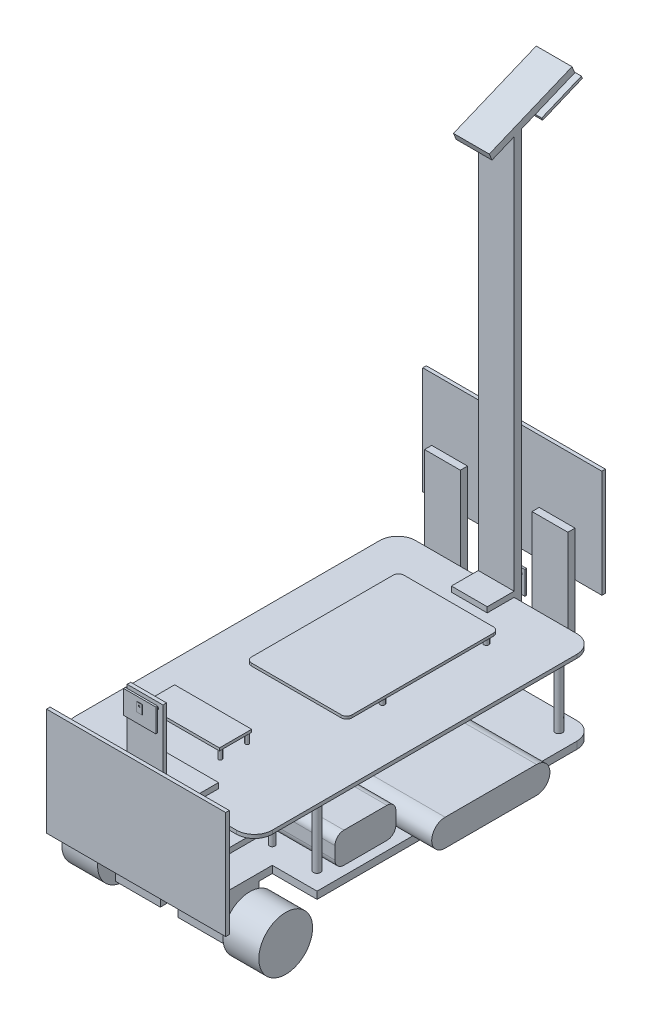
from build123d import *

# Parameters (mm, degrees)
Y_KSEKLIK_EKSTR_ZYON1_DEPTH  = 4
IZIM2_R                      = 1.5
Y_KSEKLIK_EKSTR_ZYON2_DEPTH  = 10
IZIM3_W                      = 45
IZIM3_H                      = 45
Y_KSEKLIK_EKSTR_ZYON3_DEPTH  = 3
IZIM8_R                      = 2
Y_KSEKLIK_EKSTR_ZYON7_DEPTH  = 40
Y_KSEKLIK_EKSTR_ZYON8_DEPTH  = 2
Y_KSEKLIK_EKSTR_ZYON9_DEPTH  = 25
IZIM11_W                     = 25
IZIM11_H                     = 20
Y_KSEKLIK_EKSTR_ZYON10_DEPTH = 20
IZIM12_R                     = 1.5
Y_KSEKLIK_EKSTR_ZYON11_DEPTH = 25
Y_KSEKLIK_EKSTR_ZYON12_START = 25
IZIM13_R                     = 1.5
Y_KSEKLIK_EKSTR_ZYON12_DEPTH = 25
IZIM14_R                     = 15
Y_KSEKLIK_EKSTR_ZYON13_DEPTH = 20
Y_KSEKLIK_EKSTR_ZYON14_START = -20
IZIM15_R                     = 15
Y_KSEKLIK_EKSTR_ZYON14_DEPTH = 20
Y_KSEKLIK_EKSTR_ZYON15_DEPTH = 105
Y_KSEKLIK_EKSTR_ZYON20_DEPTH = 140
IZIM19_W                     = 40
IZIM19_H                     = 30
Y_KSEKLIK_EKSTR_ZYON21_DEPTH = 5
Y_KSEKLIK_EKSTR_ZYON22_DEPTH = 20
IZIM23_R                     = 1.5
Y_KSEKLIK_EKSTR_ZYON23_DEPTH = 5
IZIM24_W                     = 100
IZIM24_H                     = 60
Y_KSEKLIK_EKSTR_ZYON24_DEPTH = 2
IZIM25_W                     = 20
IZIM25_H                     = 63
Y_KSEKLIK_EKSTR_ZYON25_DEPTH = 2
IZIM26_R                     = 1
Y_KSEKLIK_EKSTR_ZYON26_DEPTH = 2
IZIM27_W                     = 18
IZIM27_H                     = 13
Y_KSEKLIK_EKSTR_ZYON27_DEPTH = 1
IZIM29_W                     = 3
IZIM29_H                     = 5
Y_KSEKLIK_EKSTR_ZYON28_DEPTH = 0.2
IZIM30_R                     = 0.5
KES_EKSTR_ZYON1_DEPTH        = 0.2
IZIM33_W                     = 20
IZIM33_H                     = 19
Y_KSEKLIK_EKSTR_ZYON29_DEPTH = 5
IZIM35_W                     = 20
IZIM35_H                     = 4
Y_KSEKLIK_EKSTR_ZYON30_DEPTH = 46.5
IZIM36_R                     = 1.5
Y_KSEKLIK_EKSTR_ZYON31_DEPTH = 5
IZIM37_W                     = 100
IZIM37_H                     = 60
Y_KSEKLIK_EKSTR_ZYON32_DEPTH = 2
IZIM38_W                     = 20
IZIM38_H                     = 19
Y_KSEKLIK_EKSTR_ZYON33_DEPTH = 3
IZIM39_W                     = 20
IZIM39_H                     = 4
Y_KSEKLIK_EKSTR_ZYON34_DEPTH = 46
IZIM40_W                     = 20
IZIM40_H                     = 4
Y_KSEKLIK_EKSTR_ZYON35_DEPTH = 224
IZIM41_W                     = 20
IZIM41_H                     = 20
Y_KSEKLIK_EKSTR_ZYON36_DEPTH = 3
IZIM42_R                     = 1
Y_KSEKLIK_EKSTR_ZYON37_DEPTH = 3
IZIM43_W                     = 18
IZIM43_H                     = 13
Y_KSEKLIK_EKSTR_ZYON38_DEPTH = 1
IZIM44_W                     = 3
IZIM44_H                     = 5
IZIM44_R                     = 0.5
Y_KSEKLIK_EKSTR_ZYON39_DEPTH = 0.2
Y_KSEKLIK_EKSTR_ZYON40_START = -10
IZIM45_W                     = 20
IZIM45_H                     = 4
Y_KSEKLIK_EKSTR_ZYON40_DEPTH = 25
IZIM46_R                     = 1
Y_KSEKLIK_EKSTR_ZYON41_DEPTH = 2
IZIM47_W                     = 24
IZIM47_H                     = 24
Y_KSEKLIK_EKSTR_ZYON42_DEPTH = 1.5
IZIM48_R                     = 3
Y_KSEKLIK_EKSTR_ZYON43_DEPTH = 3
IZIM18_R                     = 1
Y_KSEKLIK_EKSTR_ZYON44_DEPTH = 5
IZIM51_W                     = 43
IZIM51_H                     = 18
Y_KSEKLIK_EKSTR_ZYON45_DEPTH = 1.5
IZIM52_R                     = 1.375
Y_KSEKLIK_EKSTR_ZYON46_DEPTH = 5
Y_KSEKLIK_EKSTR_ZYON47_DEPTH = 1.5


with BuildPart() as part:
    # Çizim1 → Yükseklik-Ekstrüzyon1 (new body)
    with BuildSketch(Plane(origin=(0, 0, 0), x_dir=(1, 0, 0), z_dir=(0, 1, 0))):
        with BuildLine():
            Line((85, 0), (85, 35))
            Line((85, 35), (110, 35))
            Line((110, 35), (110, 180))
            ThreePointArc((110, 180), (107.071067812, 187.071067812), (100, 190))
            Line((100, 190), (10, 190))
            ThreePointArc((10, 190), (2.928932188, 187.071067812), (0, 180))
            Line((0, 180), (0, 35))
            Line((0, 35), (25, 35))
            Line((25, 35), (25, 0))
            Line((25, 0), (85, 0))
        make_face()
    extrude(amount=Y_KSEKLIK_EKSTR_ZYON1_DEPTH)

    # Çizim2 → Yükseklik-Ekstrüzyon2 (add)
    with BuildSketch(Plane(origin=(0, 4, 0), x_dir=(1, 0, 0), z_dir=(0, 1, 0))):
        with Locations(Location((35, 45, 0), (0, 0, 270))):
            Circle(IZIM2_R)
        with Locations(Location((75, 45, 0), (0, 0, 270))):
            Circle(IZIM2_R)
        with Locations(Location((75, 5, 0), (0, 0, 270))):
            Circle(IZIM2_R)
        with Locations(Location((35, 5, 0), (0, 0, 270))):
            Circle(IZIM2_R)
    extrude(amount=Y_KSEKLIK_EKSTR_ZYON2_DEPTH)

    # Çizim3 → Yükseklik-Ekstrüzyon3 (add)
    with BuildSketch(Plane(origin=(0, 14, 0), x_dir=(1, 0, 0), z_dir=(0, 1, 0))):
        with Locations((55, 25)):
            Rectangle(IZIM3_W, IZIM3_H)
    extrude(amount=Y_KSEKLIK_EKSTR_ZYON3_DEPTH)

    # Çizim8 → Yükseklik-Ekstrüzyon7 (add)
    with BuildSketch(Plane(origin=(0, 4, 0), x_dir=(1, 0, 0), z_dir=(0, 1, 0))):
        with Locations(Location((10, 45, 0), (0, 0, 270))):
            Circle(IZIM8_R)
        with Locations(Location((100, 45, 0), (0, 0, 270))):
            Circle(IZIM8_R)
        with Locations(Location((100, 180, 0), (0, 0, 270))):
            Circle(IZIM8_R)
        with Locations(Location((10, 180, 0), (0, 0, 270))):
            Circle(IZIM8_R)
    extrude(amount=Y_KSEKLIK_EKSTR_ZYON7_DEPTH)

    # Çizim9 → Yükseklik-Ekstrüzyon8 (add)
    with BuildSketch(Plane(origin=(0, 44, 0), x_dir=(1, 0, 0), z_dir=(0, 1, 0))):
        with BuildLine():
            Line((100, 190), (10, 190))
            ThreePointArc((10, 190), (2.928932188, 187.071067812), (0, 180))
            Line((0, 180), (0, 10))
            ThreePointArc((0, 10), (2.928932188, 2.928932188), (10, 0))
            Line((10, 0), (100, 0))
            ThreePointArc((100, 0), (107.071067812, 2.928932188), (110, 10))
            Line((110, 10), (110, 180))
            ThreePointArc((110, 180), (107.071067812, 187.071067812), (100, 190))
        make_face()
    extrude(amount=Y_KSEKLIK_EKSTR_ZYON8_DEPTH)

    # Çizim10 → Yükseklik-Ekstrüzyon9 (add)
    with BuildSketch(Plane(origin=(0, 17, 0), x_dir=(1, 0, 0), z_dir=(0, 1, 0))):
        Polygon((42.5, 32.5), (44.5, 32.5), (44.5, 39.023178854), (45.5, 39.023178854), (45.5, 32.5), (47.5, 32.5), (47.5, 39.023178854), (48.5, 39.023178854), (48.5, 32.5), (50.5, 32.5), (50.5, 39.023178854), (51.5, 39.023178854), (51.5, 32.5), (53.5, 32.5), (53.5, 39.023178854), (54.5, 39.023178854), (54.5, 32.5), (56.5, 32.5), (56.5, 39.023178854), (57.5, 39.023178854), (57.5, 32.5), (59.5, 32.5), (59.5, 39.023178854), (60.5, 39.023178854), (60.5, 32.5), (62.5, 32.5), (62.5, 39.023178854), (63.5, 39.023178854), (63.5, 32.5), (65.5, 32.5), (65.5, 47.5), (63.5, 47.5), (63.5, 40.976821146), (62.5, 40.976821146), (62.5, 47.5), (60.5, 47.5), (60.5, 40.976821146), (59.5, 40.976821146), (59.5, 47.5), (57.5, 47.5), (57.5, 40.976821146), (56.5, 40.976821146), (56.5, 47.5), (54.5, 47.5), (54.5, 40.976821146), (53.5, 40.976821146), (53.5, 47.5), (51.5, 47.5), (51.5, 40.976821146), (50.5, 40.976821146), (50.5, 47.5), (48.5, 47.5), (48.5, 40.976821146), (47.5, 40.976821146), (47.5, 47.5), (45.5, 47.5), (45.5, 40.976821146), (44.5, 40.976821146), (44.5, 47.5), (42.5, 47.5), align=None)
    extrude(amount=Y_KSEKLIK_EKSTR_ZYON9_DEPTH)

    # Çizim11 → Yükseklik-Ekstrüzyon10 (add)
    with BuildSketch(Plane.XZ):
        with Locations((72.5, -17.5)):
            Rectangle(IZIM11_W, IZIM11_H)
        with Locations((37.5, -17.5)):
            Rectangle(IZIM11_W, IZIM11_H)
    extrude(amount=Y_KSEKLIK_EKSTR_ZYON10_DEPTH)

    # Çizim12 → Yükseklik-Ekstrüzyon11 (add)
    with BuildSketch(Plane(origin=(85, 0, 0), x_dir=(0, 0, -1), z_dir=(1, 0, 0))):
        with Locations(Location((17.5, -12.5, 0), (0, 0, 180))):
            Circle(IZIM12_R)
    extrude(amount=Y_KSEKLIK_EKSTR_ZYON11_DEPTH)

    # Çizim13 → Yükseklik-Ekstrüzyon12 (add)
    with BuildSketch(Plane.ZY.offset(-25).offset(Y_KSEKLIK_EKSTR_ZYON12_START)):
        with Locations((-17.5, -12.5)):
            Circle(IZIM13_R)
    extrude(amount=-Y_KSEKLIK_EKSTR_ZYON12_DEPTH)

    # Çizim14 → Yükseklik-Ekstrüzyon13 (add)
    with BuildSketch(Plane.ZY):
        with Locations((-17.5, -12.5)):
            Circle(IZIM14_R)
    extrude(amount=-Y_KSEKLIK_EKSTR_ZYON13_DEPTH)

    # Çizim15 → Yükseklik-Ekstrüzyon14 (add)
    with BuildSketch(Plane(origin=(110, 0, 0), x_dir=(0, 0, -1), z_dir=(1, 0, 0)).offset(Y_KSEKLIK_EKSTR_ZYON14_START)):
        with Locations(Location((17.5, -12.5, 0), (0, 0, 180))):
            Circle(IZIM15_R)
    extrude(amount=Y_KSEKLIK_EKSTR_ZYON14_DEPTH)

    # Çizim16 → Yükseklik-Ekstrüzyon15 (add)
    with BuildSketch(Plane.ZY):
        with BuildLine():
            Line((-55, 4), (-79, 4))
            ThreePointArc((-79, 4), (-82.535533906, 5.464466094), (-84, 9))
            Line((-84, 9), (-84, 16))
            ThreePointArc((-84, 16), (-82.535533906, 19.535533906), (-79, 21))
            Line((-79, 21), (-55, 21))
            ThreePointArc((-55, 21), (-51.464466094, 19.535533906), (-50, 16))
            Line((-50, 16), (-50, 9))
            ThreePointArc((-50, 9), (-51.464466094, 5.464466094), (-55, 4))
        make_face()
    extrude(amount=-Y_KSEKLIK_EKSTR_ZYON15_DEPTH)

    # Çizim19 → Yükseklik-Ekstrüzyon21 (add)
    with BuildSketch(Plane.XZ):
        with Locations((55, -117)):
            Rectangle(IZIM19_W, IZIM19_H)
    extrude(amount=Y_KSEKLIK_EKSTR_ZYON21_DEPTH)

    # Loft1: read off the stored shape, not the designer's step
    # Loft1: loft between two sections, ruled curve by curve
    loft1_from = [
        Edge.make_bspline([(51, -22.5, -120), (50.7, -22.5, -119.6), (50.445580716, -22.5, -119.132943755), (50.094959825, -22.5, -118.110299489), (50, -22.5, -117.555555556), (50, -22.5, -116.444444444), (50.094959825, -22.5, -115.889700511), (50.445580716, -22.5, -114.867056245), (50.7, -22.5, -114.4), (51, -22.5, -114)], [0, 0, 0, 0, 0.25, 0.25, 0.5, 0.5, 0.75, 0.75, 1, 1, 1, 1], 3),
        Edge.make_bspline([(51, -22.5, -114), (51.2, -22.5, -113.733333333), (51.437105148, -22.5, -113.473071871), (51.987552386, -22.5, -112.992681554), (52.301038062, -22.5, -112.7727797), (52.993079585, -22.5, -112.403690888), (53.371597633, -22.5, -112.254832347), (54.166863905, -22.5, -112.052859961), (54.583333333, -22.5, -112), (55.416666667, -22.5, -112), (55.833136095, -22.5, -112.052859961), (56.628402367, -22.5, -112.254832347), (57.006920415, -22.5, -112.403690888), (57.698961938, -22.5, -112.7727797), (58.012447614, -22.5, -112.992681554), (58.562894852, -22.5, -113.473071871), (58.8, -22.5, -113.733333333), (59, -22.5, -114)], [0, 0, 0, 0, 0.125, 0.125, 0.25, 0.25, 0.375, 0.375, 0.5, 0.5, 0.625, 0.625, 0.75, 0.75, 0.875, 0.875, 1, 1, 1, 1], 3),
        Edge.make_bspline([(59, -22.5, -120), (58.8, -22.5, -120.266666667), (58.562894852, -22.5, -120.526928129), (58.012447614, -22.5, -121.007318446), (57.698961938, -22.5, -121.2272203), (57.006920415, -22.5, -121.596309112), (56.628402367, -22.5, -121.745167653), (55.833136095, -22.5, -121.947140039), (55.416666667, -22.5, -122), (54.583333333, -22.5, -122), (54.166863905, -22.5, -121.947140039), (53.371597633, -22.5, -121.745167653), (52.993079585, -22.5, -121.596309112), (52.301038062, -22.5, -121.2272203), (51.987552386, -22.5, -121.007318446), (51.437105148, -22.5, -120.526928129), (51.2, -22.5, -120.266666667), (51, -22.5, -120)], [0, 0, 0, 0, 0.125, 0.125, 0.25, 0.25, 0.375, 0.375, 0.5, 0.5, 0.625, 0.625, 0.75, 0.75, 0.875, 0.875, 1, 1, 1, 1], 3),
        Edge.make_bspline([(59, -22.5, -114), (59.3, -22.5, -114.4), (59.554419284, -22.5, -114.867056245), (59.905040175, -22.5, -115.889700511), (60, -22.5, -116.444444444), (60, -22.5, -117.555555556), (59.905040175, -22.5, -118.110299489), (59.554419284, -22.5, -119.132943755), (59.3, -22.5, -119.6), (59, -22.5, -120)], [0, 0, 0, 0, 0.25, 0.25, 0.5, 0.5, 0.75, 0.75, 1, 1, 1, 1], 3),
    ]
    loft1_to = [
        Edge.make_bspline([(35, -5, -132), (35, -5, -129.5), (35, -5, -127), (35, -5, -122), (35, -5, -119.5), (35, -5, -114.5), (35, -5, -112), (35, -5, -107), (35, -5, -104.5), (35, -5, -102)], [0, 0, 0, 0, 0.25, 0.25, 0.5, 0.5, 0.75, 0.75, 1, 1, 1, 1], 3),
        Edge.make_bspline([(35, -5, -102), (36.666666667, -5, -102), (38.333333333, -5, -102), (41.666666667, -5, -102), (43.333333333, -5, -102), (46.666666667, -5, -102), (48.333333333, -5, -102), (51.666666667, -5, -102), (53.333333333, -5, -102), (56.666666667, -5, -102), (58.333333333, -5, -102), (61.666666667, -5, -102), (63.333333333, -5, -102), (66.666666667, -5, -102), (68.333333333, -5, -102), (71.666666667, -5, -102), (73.333333333, -5, -102), (75, -5, -102)], [0, 0, 0, 0, 0.125, 0.125, 0.25, 0.25, 0.375, 0.375, 0.5, 0.5, 0.625, 0.625, 0.75, 0.75, 0.875, 0.875, 1, 1, 1, 1], 3),
        Edge.make_bspline([(75, -5, -132), (73.333333333, -5, -132), (71.666666667, -5, -132), (68.333333333, -5, -132), (66.666666667, -5, -132), (63.333333333, -5, -132), (61.666666667, -5, -132), (58.333333333, -5, -132), (56.666666667, -5, -132), (53.333333333, -5, -132), (51.666666667, -5, -132), (48.333333333, -5, -132), (46.666666667, -5, -132), (43.333333333, -5, -132), (41.666666667, -5, -132), (38.333333333, -5, -132), (36.666666667, -5, -132), (35, -5, -132)], [0, 0, 0, 0, 0.125, 0.125, 0.25, 0.25, 0.375, 0.375, 0.5, 0.5, 0.625, 0.625, 0.75, 0.75, 0.875, 0.875, 1, 1, 1, 1], 3),
        Edge.make_bspline([(75, -5, -102), (75, -5, -104.5), (75, -5, -107), (75, -5, -112), (75, -5, -114.5), (75, -5, -119.5), (75, -5, -122), (75, -5, -127), (75, -5, -129.5), (75, -5, -132)], [0, 0, 0, 0, 0.25, 0.25, 0.5, 0.5, 0.75, 0.75, 1, 1, 1, 1], 3),
    ]
    loft1 = Solid(Shell([*[Face.make_surface_from_curves(loft1_from[k], loft1_to[k]) for k in range(4)], Face(Wire(loft1_from)), Face(Wire(loft1_to))]))
    add(loft1)

    # Çizim21 → Döndür1 (revolve)
    with BuildSketch(Plane.ZY.offset(-55), mode=Mode.PRIVATE) as d_nd_r1_sk:
        with BuildLine():
            Line((-117, -22.5), (-117, -27.5))
            ThreePointArc((-117, -27.5), (-113.464466094, -26.035533906), (-112, -22.5))
            Line((-112, -22.5), (-117, -22.5))
        make_face()
    revolve(d_nd_r1_sk.sketch.rotate(Axis((55, -22.5, -117), (0, -1, 0)), 180), axis=Axis((55, -22.5, -117), (0, -1, 0)))

    # Çizim22 → Yükseklik-Ekstrüzyon22 (add, symmetric)
    with BuildSketch(Plane.ZY.offset(-55)):
        Polygon((-15, 49), (0, 49), (4, 49), (4, 24), (0, 24), (0, 46), (-15, 46), align=None)
    extrude(amount=Y_KSEKLIK_EKSTR_ZYON22_DEPTH, both=True)

    # Çizim23 → Yükseklik-Ekstrüzyon23 (add)
    with BuildSketch(Plane.XY.offset(4)):
        with Locations((40, 39)):
            Circle(IZIM23_R)
        with Locations((70, 39)):
            Circle(IZIM23_R)
    extrude(amount=Y_KSEKLIK_EKSTR_ZYON23_DEPTH)

    # Çizim24 → Yükseklik-Ekstrüzyon24 (add)
    with BuildSketch(Plane.XY.offset(9)):
        with Locations((55, 32.5)):
            Rectangle(IZIM24_W, IZIM24_H)
    extrude(amount=Y_KSEKLIK_EKSTR_ZYON24_DEPTH)

    # Çizim25 → Yükseklik-Ekstrüzyon25 (add)
    with BuildSketch(Plane.XY.offset(4)):
        with Locations((55, 60.5)):
            Rectangle(IZIM25_W, IZIM25_H)
    extrude(amount=Y_KSEKLIK_EKSTR_ZYON25_DEPTH)

    # Çizim26 → Yükseklik-Ekstrüzyon26 (add)
    with BuildSketch(Plane.XY.offset(6)):
        with Locations(Location((48.5, 89, 0), (0, 0, 180))):
            Circle(IZIM26_R)
        with Locations(Location((61.5, 89, 0), (0, 0, 180))):
            Circle(IZIM26_R)
    extrude(amount=Y_KSEKLIK_EKSTR_ZYON26_DEPTH)

    # Çizim27 → Yükseklik-Ekstrüzyon27 (add)
    with BuildSketch(Plane.XY.offset(8)):
        with Locations((55, 85.5)):
            Rectangle(IZIM27_W, IZIM27_H)
    extrude(amount=Y_KSEKLIK_EKSTR_ZYON27_DEPTH)

    # Çizim29 → Yükseklik-Ekstrüzyon28 (add)
    with BuildSketch(Plane.XY.offset(9)):
        with Locations((55, 87)):
            Rectangle(IZIM29_W, IZIM29_H)
    extrude(amount=Y_KSEKLIK_EKSTR_ZYON28_DEPTH)

    # Çizim30 → Kes-Ekstrüzyon1 (cut)
    with BuildSketch(Plane.XY.offset(9.2)):
        with Locations((55, 88)):
            Circle(IZIM30_R)
    extrude(amount=-KES_EKSTR_ZYON1_DEPTH, mode=Mode.SUBTRACT)

    # Çizim33 → Yükseklik-Ekstrüzyon29 (add)
    with BuildSketch(Plane(origin=(0, 46, 0), x_dir=(1, 0, 0), z_dir=(0, 1, 0))):
        with Locations((25, 184.5)):
            Rectangle(IZIM33_W, IZIM33_H)
        with Locations((85, 184.5)):
            Rectangle(IZIM33_W, IZIM33_H)
    extrude(amount=-Y_KSEKLIK_EKSTR_ZYON29_DEPTH)

    # Çizim35 → Yükseklik-Ekstrüzyon30 (add)
    with BuildSketch(Plane(origin=(0, 46, 0), x_dir=(-1, 0, 0), z_dir=(0, 1, 0))):
        with Locations((-25, -192)):
            Rectangle(IZIM35_W, IZIM35_H)
        with Locations((-85, -192)):
            Rectangle(IZIM35_W, IZIM35_H)
    extrude(amount=Y_KSEKLIK_EKSTR_ZYON30_DEPTH)

    # Çizim36 → Yükseklik-Ekstrüzyon31 (add)
    with BuildSketch(Plane(origin=(0, 0, -194), x_dir=(-1, 0, 0), z_dir=(0, 0, -1))):
        with Locations((-25, 82.5)):
            Circle(IZIM36_R)
        with Locations((-85, 82.5)):
            Circle(IZIM36_R)
    extrude(amount=Y_KSEKLIK_EKSTR_ZYON31_DEPTH)

    # Çizim37 → Yükseklik-Ekstrüzyon32 (add)
    with BuildSketch(Plane(origin=(0, 0, -199), x_dir=(-1, 0, 0), z_dir=(0, 0, -1))):
        with Locations((-55, 92.5)):
            Rectangle(IZIM37_W, IZIM37_H)
    extrude(amount=Y_KSEKLIK_EKSTR_ZYON32_DEPTH)

    # Çizim38 → Yükseklik-Ekstrüzyon33 (add)
    with BuildSketch(Plane(origin=(0, 46, 0), x_dir=(1, 0, 0), z_dir=(0, 1, 0))):
        with Locations((55, 184.5)):
            Rectangle(IZIM38_W, IZIM38_H)
    extrude(amount=Y_KSEKLIK_EKSTR_ZYON33_DEPTH)

    # Çizim39 → Yükseklik-Ekstrüzyon34 (add)
    with BuildSketch(Plane.XZ.offset(-46)):
        with Locations((55, -192)):
            Rectangle(IZIM39_W, IZIM39_H)
    extrude(amount=Y_KSEKLIK_EKSTR_ZYON34_DEPTH)

    # Çizim40 → Yükseklik-Ekstrüzyon35 (add)
    with BuildSketch(Plane(origin=(0, 49, 0), x_dir=(1, 0, 0), z_dir=(0, 1, 0))):
        with Locations((55, 192)):
            Rectangle(IZIM40_W, IZIM40_H)
    extrude(amount=Y_KSEKLIK_EKSTR_ZYON35_DEPTH)

    # Çizim41 → Yükseklik-Ekstrüzyon36 (add)
    with BuildSketch(Plane.XZ):
        with Locations((55, -184)):
            Rectangle(IZIM41_W, IZIM41_H)
    extrude(amount=Y_KSEKLIK_EKSTR_ZYON36_DEPTH)

    # Çizim42 → Yükseklik-Ekstrüzyon37 (add)
    with BuildSketch(Plane(origin=(0, 0, -194), x_dir=(-1, 0, 0), z_dir=(0, 0, -1))):
        with Locations(Location((-61.5, 52.5, 0), (0, 0, 180))):
            Circle(IZIM42_R)
        with Locations(Location((-48.5, 52.5, 0), (0, 0, 180))):
            Circle(IZIM42_R)
    extrude(amount=Y_KSEKLIK_EKSTR_ZYON37_DEPTH)

    # Çizim43 → Yükseklik-Ekstrüzyon38 (add)
    with BuildSketch(Plane(origin=(0, 0, -197), x_dir=(-1, 0, 0), z_dir=(0, 0, -1))):
        with Locations((-55, 49)):
            Rectangle(IZIM43_W, IZIM43_H)
    extrude(amount=Y_KSEKLIK_EKSTR_ZYON38_DEPTH)

    # Çizim44 → Yükseklik-Ekstrüzyon39 (add)
    with BuildSketch(Plane(origin=(0, 0, -198), x_dir=(-1, 0, 0), z_dir=(0, 0, -1))):
        with Locations((-55, 50.5)):
            Rectangle(IZIM44_W, IZIM44_H)
        with Locations((-55, 51.5)):
            Circle(IZIM44_R, mode=Mode.SUBTRACT)
    extrude(amount=Y_KSEKLIK_EKSTR_ZYON39_DEPTH)

    # Çizim45 → Yükseklik-Ekstrüzyon40 (add, symmetric)
    with BuildSketch(Plane(origin=(0, 107.155068581, -258.695219845), x_dir=(1, 0, 0), z_dir=(0, -0.38268343236509383, 0.9238795325112852)).offset(Y_KSEKLIK_EKSTR_ZYON40_START)):
        with Locations((55, 177.509260226)):
            Rectangle(IZIM45_W, IZIM45_H)
    extrude(amount=Y_KSEKLIK_EKSTR_ZYON40_DEPTH, both=True)

    # Çizim46 → Yükseklik-Ekstrüzyon41 (add)
    with BuildSketch(Plane(origin=(0, 162.149413289, 67.164486115), x_dir=(1, 0, 0), z_dir=(0, -0.9238795325112851, -0.3826834323650937))):
        with Locations(Location((48.002823843, -307.009688213, 0), (0, 0, 270))):
            Circle(IZIM46_R)
        with Locations(Location((62, -307.009688213, 0), (0, 0, 270))):
            Circle(IZIM46_R)
    extrude(amount=Y_KSEKLIK_EKSTR_ZYON41_DEPTH)

    # Çizim47 → Yükseklik-Ekstrüzyon42 (add)
    with BuildSketch(Plane(origin=(0, 160.301654224, 66.39911925), x_dir=(1, 0, 0), z_dir=(0, -0.9238795325112852, -0.3826834323650938))):
        with Locations((55, -304.009688213)):
            Rectangle(IZIM47_W, IZIM47_H)
    extrude(amount=Y_KSEKLIK_EKSTR_ZYON42_DEPTH)

    # Çizim48 → Yükseklik-Ekstrüzyon43 (add)
    with BuildSketch(Plane(origin=(0, 158.915834925, 65.825094102), x_dir=(1, 0, 0), z_dir=(0, -0.9238795325112852, -0.3826834323650936))):
        with Locations(Location((55, -304.009688213, 0), (0, 0, 90))):
            Circle(IZIM48_R)
    extrude(amount=Y_KSEKLIK_EKSTR_ZYON43_DEPTH)

    # Çizim18 → Yükseklik-Ekstrüzyon44 (add)
    with BuildSketch(Plane(origin=(0, 46, 0), x_dir=(1, 0, 0), z_dir=(0, 1, 0))):
        with Locations(Location((20, 30, 0), (0, 0, 90))):
            Circle(IZIM18_R)
        with Locations(Location((61, 30, 0), (0, 0, 90))):
            Circle(IZIM18_R)
        with Locations(Location((61, 45, 0), (0, 0, 90))):
            Circle(IZIM18_R)
        with Locations(Location((20, 45, 0), (0, 0, 90))):
            Circle(IZIM18_R)
    extrude(amount=Y_KSEKLIK_EKSTR_ZYON44_DEPTH)

    # Çizim51 → Yükseklik-Ekstrüzyon45 (add)
    with BuildSketch(Plane(origin=(0, 51, 0), x_dir=(1, 0, 0), z_dir=(0, 1, 0))):
        with Locations((40.5, 37.5)):
            Rectangle(IZIM51_W, IZIM51_H)
    extrude(amount=Y_KSEKLIK_EKSTR_ZYON45_DEPTH)

    # Çizim52 → Yükseklik-Ekstrüzyon46 (add)
    with BuildSketch(Plane(origin=(0, 46, 0), x_dir=(1, 0, 0), z_dir=(0, 1, 0))):
        with Locations(Location((30.5, 160, 0), (0, 0, 90))):
            Circle(IZIM52_R)
        with Locations(Location((79.5, 160, 0), (0, 0, 90))):
            Circle(IZIM52_R)
        with Locations(Location((79.5, 102, 0), (0, 0, 90))):
            Circle(IZIM52_R)
        with Locations(Location((30.5, 102, 0), (0, 0, 90))):
            Circle(IZIM52_R)
    extrude(amount=Y_KSEKLIK_EKSTR_ZYON46_DEPTH)

    # Çizim53 → Yükseklik-Ekstrüzyon47 (add)
    with BuildSketch(Plane(origin=(0, 51, 0), x_dir=(1, 0, 0), z_dir=(0, 1, 0))):
        with BuildLine():
            Line((30, 163.5), (80, 163.5))
            ThreePointArc((80, 163.5), (82.121320344, 162.621320344), (83, 160.5))
            Line((83, 160.5), (83, 81.5))
            ThreePointArc((83, 81.5), (82.121320344, 79.378679656), (80, 78.5))
            Line((80, 78.5), (30, 78.5))
            ThreePointArc((30, 78.5), (27.878679656, 79.378679656), (27, 81.5))
            Line((27, 81.5), (27, 160.5))
            ThreePointArc((27, 160.5), (27.878679656, 162.621320344), (30, 163.5))
        make_face()
    extrude(amount=Y_KSEKLIK_EKSTR_ZYON47_DEPTH)


with BuildPart() as body_2:
    # Çizim17 → Yükseklik-Ekstrüzyon20 (new body)
    with BuildSketch(Plane.ZY.offset(15)):
        with BuildLine():
            Line((-91.5, 19), (-142.5, 19))
            ThreePointArc((-142.5, 19), (-150, 11.5), (-142.5, 4))
            Line((-142.5, 4), (-91.5, 4))
            ThreePointArc((-91.5, 4), (-84, 11.5), (-91.5, 19))
        make_face()
    extrude(amount=-Y_KSEKLIK_EKSTR_ZYON20_DEPTH)


solid = Compound([part.part, body_2.part])
